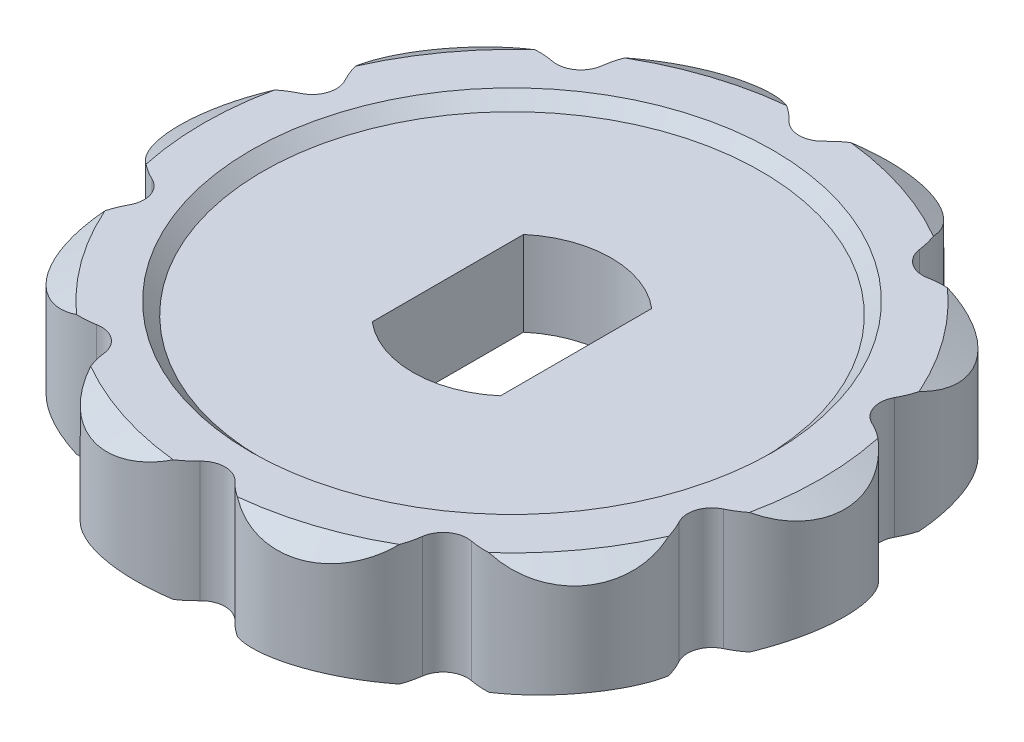
from build123d import *

# Parameters (mm, degrees)
BOSS_EXTRUDE1_DEPTH = 5
FILLET2_R           = 1
SKETCH5_R           = 10.3
CUT_EXTRUDE1_DEPTH  = 0.5
CHAMFER1_SIZE       = 0.5
SKETCH6_OUTSIDE_W   = 384.304
SKETCH6_OUTSIDE_H   = 383.29
SKETCH6_OUTSIDE_R   = 12.75
CUT_EXTRUDE2_DEPTH  = 100.2
CUT_EXTRUDE2_DRAFT  = -60
SKETCH7_OUTSIDE_W   = 177.498
SKETCH7_OUTSIDE_H   = 176.484
SKETCH7_OUTSIDE_R   = 12.75
CUT_EXTRUDE3_DEPTH  = 40.5
CUT_EXTRUDE3_DRAFT  = -60
CUT_EXTRUDE4_DEPTH  = 40.5
SKETCH9_R           = 11.4
SKETCH9_R_2         = 5.625
CUT_EXTRUDE5_DEPTH  = 3.4
SKETCH10_R          = 6
CUT_EXTRUDE6_DEPTH  = 1


with BuildPart() as part:
    # Sketch1 → Boss-Extrude1 (new body)
    with BuildSketch(Plane(origin=(0, 0, 0), x_dir=(1, 0, 0), z_dir=(0, 1, 0))):
        with BuildLine():
            ThreePointArc((0, 11), (4.248983673, 13.077027099), (6.465637775, 8.899186938))
            ThreePointArc((6.465637775, 8.899186938), (11.123983673, 8.082047219), (10.461621679, 3.399186938))
            ThreePointArc((10.461621679, 3.399186938), (13.75, 0), (10.461621679, -3.399186938))
            ThreePointArc((10.461621679, -3.399186938), (11.123983673, -8.082047219), (6.465637775, -8.899186938))
            ThreePointArc((6.465637775, -8.899186938), (4.248983673, -13.077027099), (0, -11))
            ThreePointArc((0, -11), (-4.248983673, -13.077027099), (-6.465637775, -8.899186938))
            ThreePointArc((-6.465637775, -8.899186938), (-11.123983673, -8.082047219), (-10.461621679, -3.399186938))
            ThreePointArc((-10.461621679, -3.399186938), (-13.75, 0), (-10.461621679, 3.399186938))
            ThreePointArc((-10.461621679, 3.399186938), (-11.123983673, 8.082047219), (-6.465637775, 8.899186938))
            ThreePointArc((-6.465637775, 8.899186938), (-4.248983673, 13.077027099), (0, 11))
        make_face()
    extrude(amount=BOSS_EXTRUDE1_DEPTH)

    # Fillet2
    fillet2_edges = [part.edges().sort_by_distance(p)[0] for p in [
        (10.461621679, 2.5, -3.399186938),
        (10.461621679, 2.5, 3.399186938),
        (6.465637775, 2.5, 8.899186938),
        (0, 2.5, 11),
        (-6.465637775, 2.5, 8.899186938),
        (-10.461621679, 2.5, 3.399186938),
        (-10.461621679, 2.5, -3.399186938),
        (-6.465637775, 2.5, -8.899186938),
        (0, 2.5, -11),
        (6.465637775, 2.5, -8.899186938),
    ]]
    fillet(fillet2_edges, radius=FILLET2_R)

    # Sketch5 → Cut-Extrude1 (cut)
    with BuildSketch(Plane(origin=(0, 5, 0), x_dir=(1, 0, 0), z_dir=(0, 1, 0))):
        with Locations(Location((0, 0, 0), (0, 0, 270))):
            Circle(SKETCH5_R)
    extrude(amount=-CUT_EXTRUDE1_DEPTH, mode=Mode.SUBTRACT)

    # Chamfer1
    chamfer1_edges = [part.edges().sort_by_distance(p)[0] for p in [
        (0, 5, -10.3),
    ]]
    chamfer(chamfer1_edges, length=CHAMFER1_SIZE - 0.0001)  # a hair under: the kernel refuses the full size


with BuildPart() as cut_extrude2_tool:
    # Sketch6 outside → Cut-Extrude2 (with draft: the straight prism first)
    with BuildSketch(Plane(origin=(0, 5, 0), x_dir=(1, 0, 0), z_dir=(0, 1, 0))):
        Rectangle(SKETCH6_OUTSIDE_W, SKETCH6_OUTSIDE_H)
        Circle(SKETCH6_OUTSIDE_R, mode=Mode.SUBTRACT)
    extrude(amount=-CUT_EXTRUDE2_DEPTH)
    # Cut-Extrude2: the draft: its side faces are tilted about the plane it starts from
    cut_extrude2_sides = [cut_extrude2_tool.faces().sort_by_distance(p)[0] for p in [
        (0, -45.1, 191.645),
        (192.152, -45.1, 0),
        (0, -45.1, -191.645),
        (-192.152, -45.1, 0),
        (-12.75, -45.1, 0),
    ]]
    draft(cut_extrude2_sides, Plane(origin=(0, 5, 0), x_dir=(1, 0, 0), z_dir=(0, 1, 0)), CUT_EXTRUDE2_DRAFT)


with BuildPart() as part_1:
    add(part.part)

    # Cut-Extrude2: cut by cut_extrude2_tool
    add(cut_extrude2_tool.part, mode=Mode.SUBTRACT)


with BuildPart() as cut_extrude3_tool:
    # Sketch7 outside → Cut-Extrude3 (with draft: the straight prism first)
    with BuildSketch(Plane.XZ):
        Rectangle(SKETCH7_OUTSIDE_W, SKETCH7_OUTSIDE_H)
        Circle(SKETCH7_OUTSIDE_R, mode=Mode.SUBTRACT)
    extrude(amount=-CUT_EXTRUDE3_DEPTH)
    # Cut-Extrude3: the draft: its side faces are tilted about the plane it starts from
    cut_extrude3_sides = [cut_extrude3_tool.faces().sort_by_distance(p)[0] for p in [
        (0, 20.25, -88.242),
        (88.749, 20.25, 0),
        (0, 20.25, 88.242),
        (-88.749, 20.25, 0),
        (-12.75, 20.25, 0),
    ]]
    draft(cut_extrude3_sides, Plane.XZ, CUT_EXTRUDE3_DRAFT)


with BuildPart() as part_2:
    add(part_1.part)

    # Cut-Extrude3: cut by cut_extrude3_tool
    add(cut_extrude3_tool.part, mode=Mode.SUBTRACT)

    # Sketch8 → Cut-Extrude4 (cut)
    with BuildSketch(Plane(origin=(0, 4.5, 0), x_dir=(1, 0, 0), z_dir=(0, 1, 0))):
        with BuildLine():
            Line((-2.65, -3.128498042), (-2.65, 3.128498042))
            ThreePointArc((-2.65, 3.128498042), (0, 4.1), (2.65, 3.128498042))
            Line((2.65, 3.128498042), (2.65, -3.128498042))
            ThreePointArc((2.65, -3.128498042), (0, -4.1), (-2.65, -3.128498042))
        make_face()
    extrude(amount=-CUT_EXTRUDE4_DEPTH, mode=Mode.SUBTRACT)

    # Sketch9 → Cut-Extrude5 (cut)
    with BuildSketch(Plane.XZ):
        with Locations(Location((0, 0, 0), (0, 0, 270))):
            Circle(SKETCH9_R)
        with Locations(Location((0, 0, 0), (0, 0, 270))):
            Circle(SKETCH9_R_2, mode=Mode.SUBTRACT)
    extrude(amount=-CUT_EXTRUDE5_DEPTH, mode=Mode.SUBTRACT)

    # Sketch10 → Cut-Extrude6 (cut)
    with BuildSketch(Plane.XZ):
        Circle(SKETCH10_R)
    extrude(amount=-CUT_EXTRUDE6_DEPTH, mode=Mode.SUBTRACT)


solid = part_2.part
